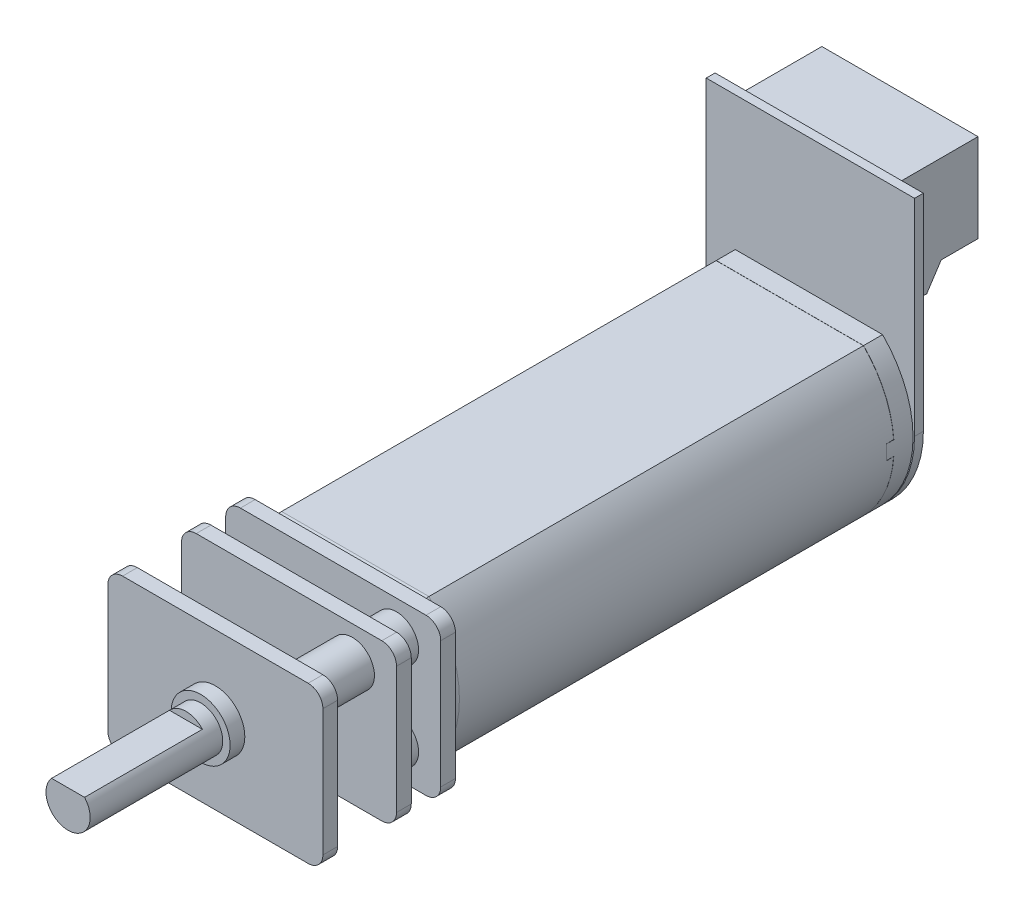
from build123d import *

# Parameters (mm, degrees)
BOSS_EXTRUDE1_DEPTH                  = 15
FILLET1_R                            = 0.5
SKETCH2_W                            = 1
SKETCH2_H                            = 1
CUT_EXTRUDE1_DEPTH                   = 8
BOSS_EXTRUDE2_REACH                  = 19.321
BOSS_EXTRUDE2_END_RADIUS             = 7.071067812
BOSS_EXTRUDE2_DIRECTION_2_REACH      = 19.321
BOSS_EXTRUDE2_DIRECTION_2_END_RADIUS = 7.071067812
SKETCH4_W                            = 1
SKETCH4_H                            = 1
BOSS_EXTRUDE3_DEPTH                  = 1
BOSS_EXTRUDE4_DEPTH                  = 0.6
BOSS_EXTRUDE5_DEPTH                  = 5.3
SHELL1_START                         = -4.6
SHELL1_DEPTH                         = 9.2
BOSS_EXTRUDE6_DEPTH                  = 1
SKETCH8_R                            = 1.5
BOSS_EXTRUDE7_DEPTH                  = 2
BOSS_EXTRUDE8_DEPTH                  = 1
SKETCH12_R                           = 1.5
BOSS_EXTRUDE9_DEPTH                  = 4
BOSS_EXTRUDE10_DEPTH                 = 1
SKETCH14_R                           = 1.5
CUT_EXTRUDE2_DEPTH                   = 1
BOSS_EXTRUDE11_START                 = 1
SKETCH15_R                           = 2
SKETCH15_R_2                         = 1.5
BOSS_EXTRUDE11_DEPTH                 = 1
BOSS_EXTRUDE12_START                 = -11
SKETCH16_R                           = 1.5
BOSS_EXTRUDE12_DEPTH                 = 11
SKETCH17_W                           = 4.75514305
SKETCH17_H                           = 2
CUT_EXTRUDE3_DEPTH                   = 8


# Read off the part's stored shape, not the designer's step: Shell1
with BuildPart() as part:
    # Sketch1 → Boss-Extrude1 (new, symmetric)
    with BuildSketch(Plane.XY):
        with BuildLine():
            Line((-5, 5), (5, 5))
            ThreePointArc((5, 5), (7.071067812, 0), (5, -5))
            Line((5, -5), (-5, -5))
            ThreePointArc((-5, -5), (-7.071067812, 0), (-5, 5))
        make_face()
    extrude(amount=BOSS_EXTRUDE1_DEPTH, both=True)

    # Fillet1
    fillet1_edges = [part.edges().sort_by_distance(p)[0] for p in [
        (-7.071067812, 0, 15),
        (0, -5, 15),
        (7.071067812, 0, 15),
        (0, 5, 15),
    ]]
    fillet(fillet1_edges, radius=FILLET1_R)

    # Sketch2 → Cut-Extrude1 (cut, symmetric)
    with BuildSketch(Plane(origin=(0, 0, 0), x_dir=(0, 0, -1), z_dir=(1, 0, 0))):
        with Locations((15, 0)):
            Rectangle(SKETCH2_W, SKETCH2_H)
    extrude(amount=CUT_EXTRUDE1_DEPTH, both=True, mode=Mode.SUBTRACT)

    # Sketch7 → Boss-Extrude6 (add)
    with BuildSketch(Plane.XY.offset(15)):
        with BuildLine():
            Line((-6.3, 5.3), (6.3, 5.3))
            ThreePointArc((6.3, 5.3), (7.007106781, 5.007106781), (7.3, 4.3))
            Line((7.3, 4.3), (7.3, -4.3))
            ThreePointArc((7.3, -4.3), (7.007106781, -5.007106781), (6.3, -5.3))
            Line((6.3, -5.3), (-6.3, -5.3))
            ThreePointArc((-6.3, -5.3), (-7.007106781, -5.007106781), (-7.3, -4.3))
            Line((-7.3, -4.3), (-7.3, 4.3))
            ThreePointArc((-7.3, 4.3), (-7.007106781, 5.007106781), (-6.3, 5.3))
        make_face()
    extrude(amount=BOSS_EXTRUDE6_DEPTH)

    # Sketch8 → Boss-Extrude7 (add)
    with BuildSketch(Plane.XY.offset(16)):
        with Locations((4.3, 3)):
            Circle(SKETCH8_R)
        with Locations((4.3, -3)):
            Circle(SKETCH8_R)
        with Locations((-4.3, -3)):
            Circle(SKETCH8_R)
    extrude(amount=BOSS_EXTRUDE7_DEPTH)

    # Sketch10 → Boss-Extrude8 (add)
    with BuildSketch(Plane.XY.offset(18)):
        with BuildLine():
            Line((7.3, -4.3), (7.3, 4.3))
            ThreePointArc((7.3, 4.3), (7.007106781, 5.007106781), (6.3, 5.3))
            Line((6.3, 5.3), (-6.3, 5.3))
            ThreePointArc((-6.3, 5.3), (-7.007106781, 5.007106781), (-7.3, 4.3))
            Line((-7.3, 4.3), (-7.3, -4.3))
            ThreePointArc((-7.3, -4.3), (-7.007106781, -5.007106781), (-6.3, -5.3))
            Line((-6.3, -5.3), (6.3, -5.3))
            ThreePointArc((6.3, -5.3), (7.007106781, -5.007106781), (7.3, -4.3))
        make_face()
    extrude(amount=BOSS_EXTRUDE8_DEPTH)

    # Sketch12 → Boss-Extrude9 (add)
    with BuildSketch(Plane.XY.offset(19)):
        with Locations((-4.3, -3)):
            Circle(SKETCH12_R)
        with Locations((4.3, 3)):
            Circle(SKETCH12_R)
    extrude(amount=BOSS_EXTRUDE9_DEPTH)

    # Sketch13 → Boss-Extrude10 (add)
    with BuildSketch(Plane.XY.offset(23)):
        with BuildLine():
            Line((6.3, 5.3), (-6.3, 5.3))
            ThreePointArc((-6.3, 5.3), (-7.007106781, 5.007106781), (-7.3, 4.3))
            Line((-7.3, 4.3), (-7.3, -4.3))
            ThreePointArc((-7.3, -4.3), (-7.007106781, -5.007106781), (-6.3, -5.3))
            Line((-6.3, -5.3), (6.3, -5.3))
            ThreePointArc((6.3, -5.3), (7.007106781, -5.007106781), (7.3, -4.3))
            Line((7.3, -4.3), (7.3, 4.3))
            ThreePointArc((7.3, 4.3), (7.007106781, 5.007106781), (6.3, 5.3))
        make_face()
    extrude(amount=BOSS_EXTRUDE10_DEPTH)

    # Sketch14 → Cut-Extrude2 (cut)
    with BuildSketch(Plane.XY.offset(24)):
        Circle(SKETCH14_R)
    extrude(amount=-CUT_EXTRUDE2_DEPTH, mode=Mode.SUBTRACT)

    # Sketch15 → Boss-Extrude11 (add)
    with BuildSketch(Plane.XY.offset(24).offset(BOSS_EXTRUDE11_START)):
        Circle(SKETCH15_R)
        Circle(SKETCH15_R_2, mode=Mode.SUBTRACT)
    extrude(amount=-BOSS_EXTRUDE11_DEPTH)

    # Sketch16 → Boss-Extrude12 (add)
    with BuildSketch(Plane(origin=(0, 0, 23), x_dir=(-1, 0, 0), z_dir=(0, 0, -1)).offset(BOSS_EXTRUDE12_START)):
        Circle(SKETCH16_R)
    extrude(amount=BOSS_EXTRUDE12_DEPTH)

    # Sketch17 → Cut-Extrude3 (cut)
    with BuildSketch(Plane.XY.offset(34)):
        with Locations((-0.015438776, 2)):
            Rectangle(SKETCH17_W, SKETCH17_H)
    extrude(amount=-CUT_EXTRUDE3_DEPTH, mode=Mode.SUBTRACT)


with BuildPart() as body_2:
    # Boss-Extrude2: up to this cylinder (the profile starts inside it)
    boss_extrude2_end = Plane(origin=(0, 0, -15.622248), z_dir=(0, 0, -1)) * Cylinder(BOSS_EXTRUDE2_END_RADIUS, 53.784135624, mode=Mode.PRIVATE)
    # Sketch3 → Boss-Extrude2 (new, up to the surface)
    with BuildSketch(Plane(origin=(0, 0, 0), x_dir=(0, 0, -1), z_dir=(1, 0, 0)), mode=Mode.PRIVATE) as boss_extrude2_sk1:
        Polygon((15.01, -5), (16.3, -5), (16.3, 5), (15.01, 5), (15.01, 0.49), (14.51, 0.49), (14.51, -0.49), (15.01, -0.49), align=None)
    boss_extrude2_tool1 = extrude(boss_extrude2_sk1.sketch, amount=BOSS_EXTRUDE2_REACH, mode=Mode.PRIVATE) & boss_extrude2_end
    add(boss_extrude2_tool1.solids().sort_by_distance((0, 0, -15.622248))[0])

    # Boss-Extrude2 direction 2: up to this cylinder (the profile starts inside it)
    boss_extrude2_direction_2_end = Plane(origin=(0, 0, -15.622248), z_dir=(0, 0, -1)) * Cylinder(BOSS_EXTRUDE2_DIRECTION_2_END_RADIUS, 53.784135624, mode=Mode.PRIVATE)
    # Sketch3 → Boss-Extrude2 direction 2 (add, up to the surface)
    with BuildSketch(Plane(origin=(0, 0, 0), x_dir=(0, 0, -1), z_dir=(1, 0, 0)), mode=Mode.PRIVATE) as boss_extrude2_direction_2_sk1:
        Polygon((15.01, -5), (16.3, -5), (16.3, 5), (15.01, 5), (15.01, 0.49), (14.51, 0.49), (14.51, -0.49), (15.01, -0.49), align=None)
    boss_extrude2_direction_2_tool1 = extrude(boss_extrude2_direction_2_sk1.sketch, amount=-BOSS_EXTRUDE2_DIRECTION_2_REACH, mode=Mode.PRIVATE) & boss_extrude2_direction_2_end
    add(boss_extrude2_direction_2_tool1.solids().sort_by_distance((0, 0, -15.622248))[0])

    # Sketch4 → Boss-Extrude3 (add)
    with BuildSketch(Plane(origin=(0, 0, -16.3), x_dir=(-1, 0, 0), z_dir=(0, 0, -1))):
        Rectangle(SKETCH4_W, SKETCH4_H)
    extrude(amount=BOSS_EXTRUDE3_DEPTH)

    # Sketch5 → Boss-Extrude4 (add)
    with BuildSketch(Plane(origin=(0, 0, -16.4), x_dir=(-1, 0, 0), z_dir=(0, 0, -1))):
        with BuildLine():
            Line((-5, -5), (5, -5))
            ThreePointArc((5, -5), (6.532814824, -2.705980501), (7.071067812, 0))
            Line((7.071067812, 0), (7.071067812, 14))
            Line((7.071067812, 14), (-7.071067812, 14))
            Line((-7.071067812, 14), (-7.071067812, 0))
            ThreePointArc((-7.071067812, 0), (-6.532814824, -2.705980501), (-5, -5))
        make_face()
    extrude(amount=BOSS_EXTRUDE4_DEPTH)

    # Sketch6 → Boss-Extrude5 (add, symmetric)
    with BuildSketch(Plane(origin=(0, 0, 0), x_dir=(0, 0, -1), z_dir=(1, 0, 0))):
        Polygon((17, 13.7), (22.48, 13.7), (22.48, 7.7), (19.98, 7.7), (19, 6.2), (17, 6.2), align=None)
    extrude(amount=BOSS_EXTRUDE5_DEPTH, both=True)

    # Shell1 outline → Shell1 (cut)
    with BuildSketch(Plane.YZ.offset(SHELL1_START)):
        Polygon((13, -17.1), (6.9, -17.1), (6.9, -18.621179174), (8.4, -19.601179174), (8.4, -22.48), (13, -22.48), align=None)
    extrude(amount=SHELL1_DEPTH, mode=Mode.SUBTRACT)


solid = Compound([part.part, body_2.part])
